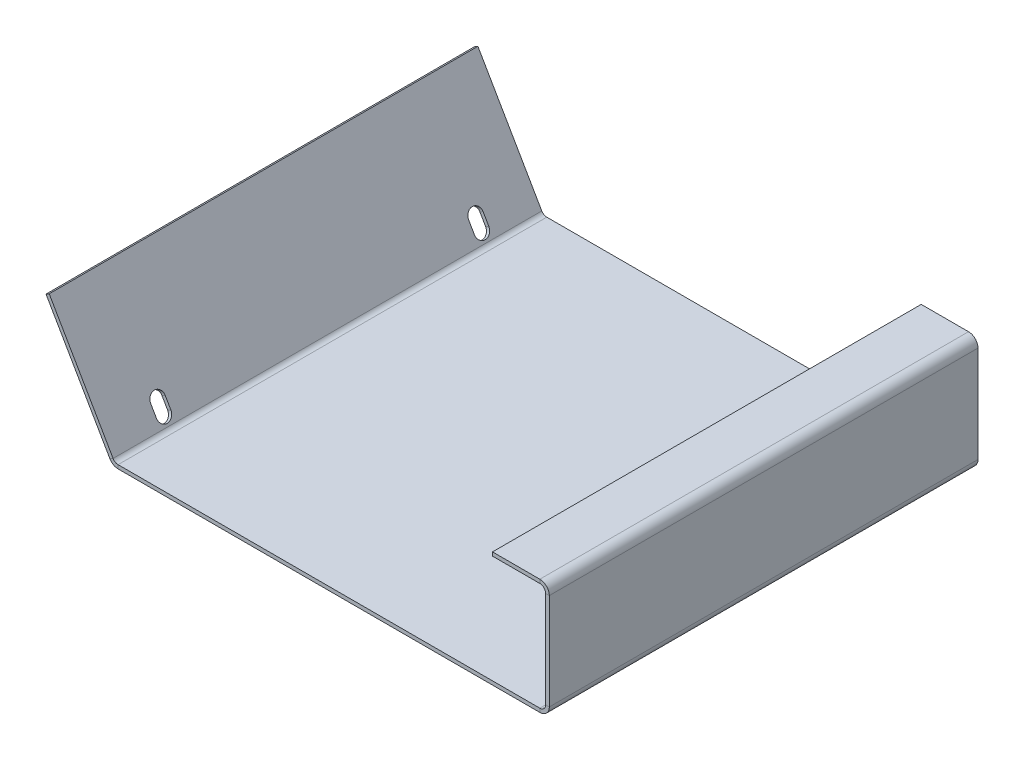
from build123d import *

# Parameters (mm, degrees)
BASE_FLANGE1_START = -94.375
BASE_FLANGE1_DEPTH = 188.75
CUT_EXTRUDE1_REACH = 246.612


# Read off the part's stored shape, not the designer's step: Base-Flange1
with BuildPart() as part:
    # Base-Flange1 outline → Base-Flange1 (new body)
    with BuildSketch(Plane.XY.offset(BASE_FLANGE1_START)):
        with BuildLine():
            Line((-332.415300569, 2.8956), (-360.542189104, 51.6128))
            Line((-360.542189104, 51.6128), (-361.95, 50.8))
            Line((-361.95, 50.8), (-333.823111466, 2.0828))
            ThreePointArc((-333.823111466, 2.0828), (-332.298396044, 0.558084578), (-330.215596044, 0))
            Line((-330.215596044, 0), (-144.5156, 0))
            ThreePointArc((-144.5156, 0), (-141.570075992, 1.220075992), (-140.35, 4.1656))
            Line((-140.35, 4.1656), (-140.35, 46.6344))
            ThreePointArc((-140.35, 46.6344), (-141.570075992, 49.579924008), (-144.5156, 50.8))
            Line((-144.5156, 50.8), (-165.35, 50.8))
            Line((-165.35, 50.8), (-165.35, 49.1744))
            Line((-165.35, 49.1744), (-144.5156, 49.1744))
            ThreePointArc((-144.5156, 49.1744), (-142.719548776, 48.430451224), (-141.9756, 46.6344))
            Line((-141.9756, 46.6344), (-141.9756, 4.1656))
            ThreePointArc((-141.9756, 4.1656), (-142.719548776, 2.369548776), (-144.5156, 1.6256))
            Line((-144.5156, 1.6256), (-330.215596044, 1.6256))
            ThreePointArc((-330.215596044, 1.6256), (-331.485596044, 1.965895474), (-332.415300569, 2.8956))
        make_face()
    extrude(amount=BASE_FLANGE1_DEPTH)

    # Sketch15 → Cut-Extrude1 (cut, up to next)
    with BuildSketch(Plane(origin=(-249.465454744, -144.02894745, 0), x_dir=(0, 0, 1), z_dir=(-0.8660254037844362, -0.5000000000000044, 0)), mode=Mode.PRIVATE) as cut_extrude1_sk1:
        with BuildLine():
            Line((66.825, 172.969090512), (66.825, 177.969090512))
            ThreePointArc((66.825, 177.969090512), (70, 181.144090512), (73.175, 177.969090512))
            Line((73.175, 177.969090512), (73.175, 172.969090512))
            ThreePointArc((73.175, 172.969090512), (70, 169.794090512), (66.825, 172.969090512))
        make_face()
    cut_extrude1_tool1 = extrude(cut_extrude1_sk1.sketch, amount=-CUT_EXTRUDE1_REACH, mode=Mode.PRIVATE) & part.part
    # Sketch15 → Cut-Extrude1 (cut, up to next)
    with BuildSketch(Plane(origin=(-249.465454744, -144.02894745, 0), x_dir=(0, 0, 1), z_dir=(-0.8660254037844362, -0.5000000000000044, 0)), mode=Mode.PRIVATE) as cut_extrude1_sk2:
        with BuildLine():
            Line((-66.825, 172.969090512), (-66.825, 177.969090512))
            ThreePointArc((-66.825, 177.969090512), (-70, 181.144090512), (-73.175, 177.969090512))
            Line((-73.175, 177.969090512), (-73.175, 172.969090512))
            ThreePointArc((-73.175, 172.969090512), (-70, 169.794090512), (-66.825, 172.969090512))
        make_face()
    cut_extrude1_tool2 = extrude(cut_extrude1_sk2.sketch, amount=-CUT_EXTRUDE1_REACH, mode=Mode.PRIVATE) & part.part
    add(cut_extrude1_tool1.solids().sort_by_distance((-337.2, 7.931743, 70))[0], mode=Mode.SUBTRACT)
    add(cut_extrude1_tool2.solids().sort_by_distance((-337.2, 7.931743, -70))[0], mode=Mode.SUBTRACT)


solid = part.part
